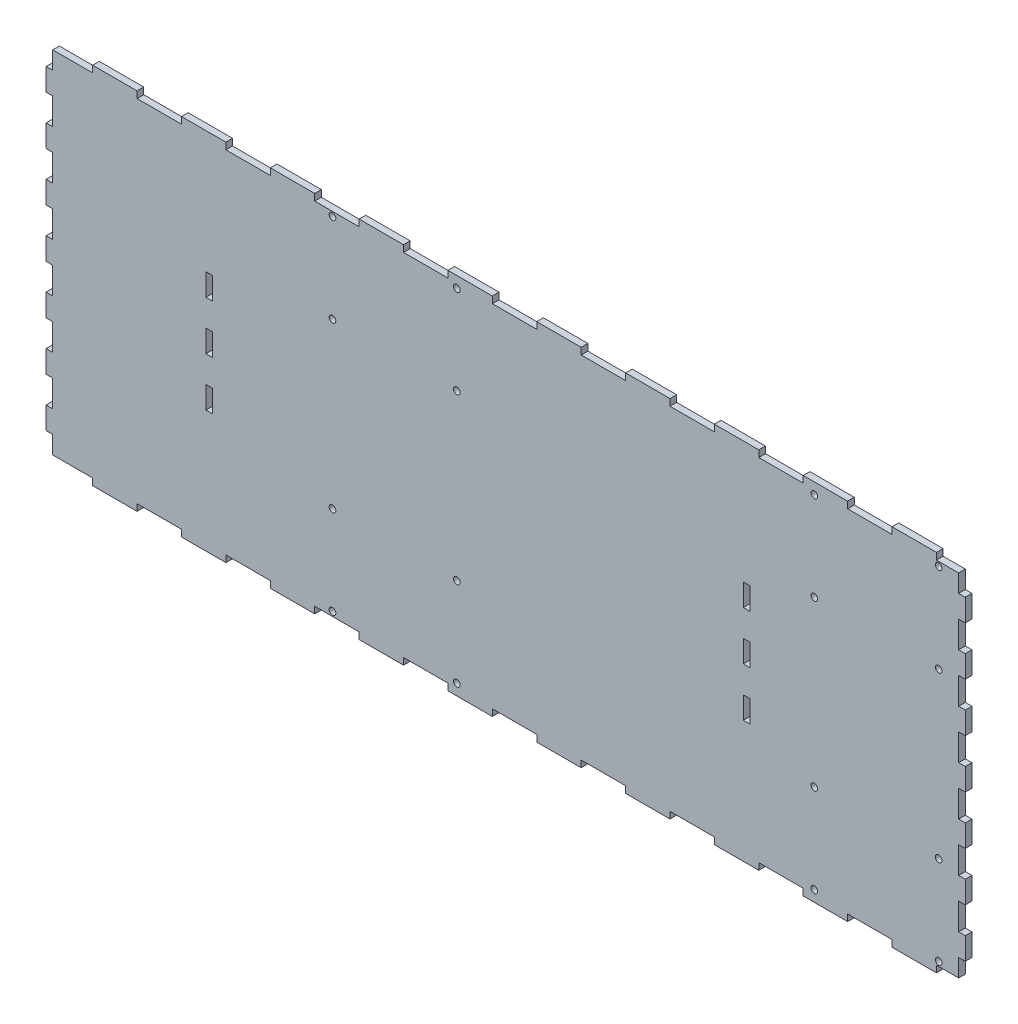
from build123d import *

# Parameters (mm, degrees)
SKETCH1_W           = 414
SKETCH1_H           = 164
BOSS_EXTRUDE1_DEPTH = 3
SKETCH2_W           = 3
SKETCH2_H           = 11
SKETCH2_H_2         = 12
CUT_EXTRUDE1_DEPTH  = 3
CUT_EXTRUDE2_DEPTH  = 3
SKETCH4_R           = 1.5
SKETCH4_W           = 3
SKETCH4_H           = 10
CUT_EXTRUDE3_DEPTH  = 10


with BuildPart() as part:
    # Sketch1 → Boss-Extrude1 (new body)
    with BuildSketch(Plane.XY.offset(152)):
        Rectangle(SKETCH1_W, SKETCH1_H)
    extrude(amount=BOSS_EXTRUDE1_DEPTH)

    # Sketch2 → Cut-Extrude1 (cut)
    with BuildSketch(Plane.ZY.offset(207)):
        with Locations((153.5, -76.5)):
            Rectangle(SKETCH2_W, SKETCH2_H)
        with Locations((153.5, -55)):
            Rectangle(SKETCH2_W, SKETCH2_H_2)
        with Locations((153.5, -33)):
            Rectangle(SKETCH2_W, SKETCH2_H_2)
        with Locations((153.5, -11)):
            Rectangle(SKETCH2_W, SKETCH2_H_2)
        with Locations((153.5, 11)):
            Rectangle(SKETCH2_W, SKETCH2_H_2)
        with Locations((153.5, 33)):
            Rectangle(SKETCH2_W, SKETCH2_H_2)
        with Locations((153.5, 55)):
            Rectangle(SKETCH2_W, SKETCH2_H_2)
        with Locations((153.5, 76.5)):
            Rectangle(SKETCH2_W, SKETCH2_H)
    cut_extrude1 = extrude(amount=-CUT_EXTRUDE1_DEPTH, mode=Mode.SUBTRACT)

    # Mirror1: Cut-Extrude1 across plane
    add(cut_extrude1.mirror(Plane(origin=(0, 0, 0), x_dir=(0, 0, 1), z_dir=(1, 0, 0))), mode=Mode.SUBTRACT)

    # Sketch3 → Cut-Extrude2 (cut)
    with BuildSketch(Plane(origin=(0, 82, 0), x_dir=(1, 0, 0), z_dir=(0, 1, 0))):
        Polygon((174, -152), (194, -152), (194, -155), (204, -155), (204, -145), (207, -145), (207, -133), (204, -133), (204, -123), (207, -123), (207, -111), (204, -111), (204, -101), (207, -101), (207, -89), (204, -89), (204, -79), (207, -79), (207, -67), (204, -67), (204, -57), (207, -57), (207, -45), (204, -45), (204, -35), (207, -35), (207, -23), (204, -23), (204, -16), (-204, -16), (-204, -23), (-207, -23), (-207, -35), (-204, -35), (-204, -45), (-207, -45), (-207, -57), (-204, -57), (-204, -67), (-207, -67), (-207, -79), (-204, -79), (-204, -89), (-207, -89), (-207, -101), (-204, -101), (-204, -111), (-207, -111), (-207, -123), (-204, -123), (-204, -133), (-207, -133), (-207, -145), (-204, -145), (-204, -155), (-186, -155), (-186, -152), (-166, -152), (-166, -155), (-146, -155), (-146, -152), (-126, -152), (-126, -155), (-106, -155), (-106, -152), (-86, -152), (-86, -155), (-66, -155), (-66, -152), (-46, -152), (-46, -155), (-26, -155), (-26, -152), (-6, -152), (-6, -155), (14, -155), (14, -152), (34, -152), (34, -155), (54, -155), (54, -152), (74, -152), (74, -155), (94, -155), (94, -152), (114, -152), (114, -155), (134, -155), (134, -152), (154, -152), (154, -155), (174, -155), align=None)
    cut_extrude2 = extrude(amount=-CUT_EXTRUDE2_DEPTH, mode=Mode.SUBTRACT)

    # Mirror2: Cut-Extrude2 across plane
    add(cut_extrude2.mirror(Plane.ZX), mode=Mode.SUBTRACT)

    # Sketch4 → Cut-Extrude3 (cut)
    with BuildSketch(Plane.XY.offset(155)):
        with Locations((139, 37)):
            Circle(SKETCH4_R)
        with Locations((195, 37)):
            Circle(SKETCH4_R)
        with Locations((195, 77)):
            Circle(SKETCH4_R)
        with Locations((139, 77)):
            Circle(SKETCH4_R)
        with Locations((-78, 77)):
            Circle(SKETCH4_R)
        with Locations((-22, 77)):
            Circle(SKETCH4_R)
        with Locations((-78, 37)):
            Circle(SKETCH4_R)
        with Locations((-22, 37)):
            Circle(SKETCH4_R)
        with Locations((139, -77)):
            Circle(SKETCH4_R)
        with Locations((195, -77)):
            Circle(SKETCH4_R)
        with Locations((195, -37)):
            Circle(SKETCH4_R)
        with Locations((139, -37)):
            Circle(SKETCH4_R)
        with Locations((-22, -37)):
            Circle(SKETCH4_R)
        with Locations((-78, -37)):
            Circle(SKETCH4_R)
        with Locations((-22, -77)):
            Circle(SKETCH4_R)
        with Locations((-78, -77)):
            Circle(SKETCH4_R)
        with Locations((-133.5, 22)):
            Rectangle(SKETCH4_W, SKETCH4_H)
        with Locations((-133.5, 0)):
            Rectangle(SKETCH4_W, SKETCH4_H)
        with Locations((-133.5, -22)):
            Rectangle(SKETCH4_W, SKETCH4_H)
        with Locations((108.5, 22)):
            Rectangle(SKETCH4_W, SKETCH4_H)
        with Locations((108.5, 0)):
            Rectangle(SKETCH4_W, SKETCH4_H)
        with Locations((108.5, -22)):
            Rectangle(SKETCH4_W, SKETCH4_H)
    extrude(amount=-CUT_EXTRUDE3_DEPTH, mode=Mode.SUBTRACT)


solid = part.part
